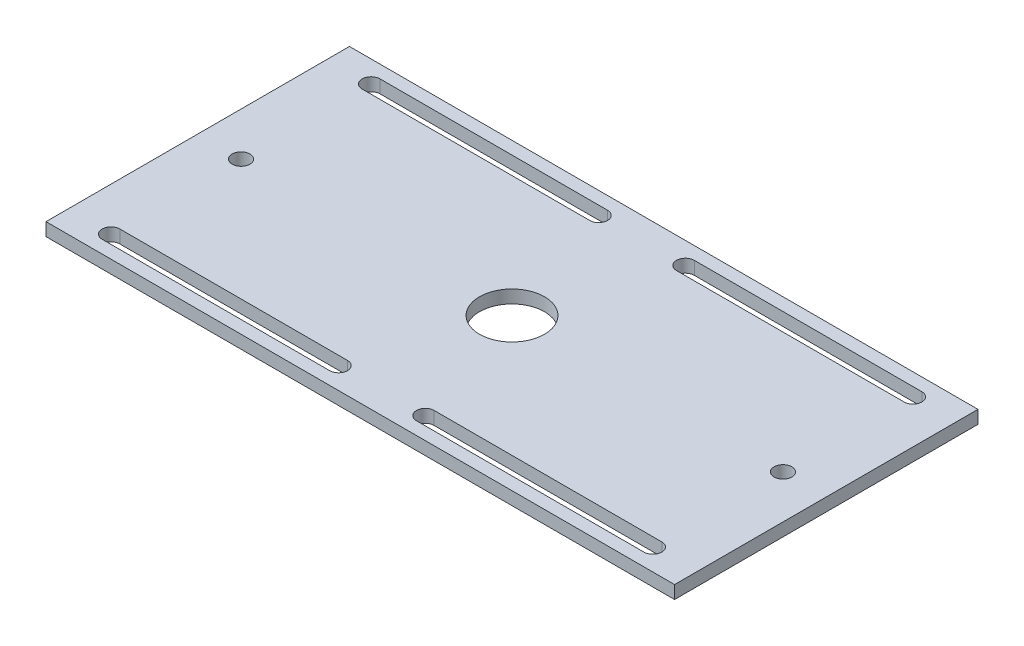
from build123d import *

# Parameters (mm, degrees)
SKETCH_1_W      = 290
SKETCH_1_H      = 140
SKETCH_1_R      = 4.1
SKETCH_1_R_2    = 15
EXTRUDE_1_DEPTH = 6


with BuildPart() as part:
    # Эскиз1 → Бобышка-Вытянуть1 (new body)
    with BuildSketch(Plane(origin=(0, 0, 0), x_dir=(1, 0, 0), z_dir=(0, 1, 0))):
        Rectangle(SKETCH_1_W, SKETCH_1_H)
        with Locations((-125, 0)):
            Circle(SKETCH_1_R, mode=Mode.SUBTRACT)
        with Locations((125, 0)):
            Circle(SKETCH_1_R, mode=Mode.SUBTRACT)
        Circle(SKETCH_1_R_2, mode=Mode.SUBTRACT)
        with BuildLine():
            Line((-125, 64.1), (-20, 64.1))
            ThreePointArc((-20, 64.1), (-15.9, 60), (-20, 55.9))
            Line((-20, 55.9), (-125, 55.9))
            ThreePointArc((-125, 55.9), (-129.1, 60), (-125, 64.1))
        make_face(mode=Mode.SUBTRACT)
        with BuildLine():
            Line((-125, -55.9), (-20, -55.9))
            ThreePointArc((-20, -55.9), (-15.9, -60), (-20, -64.1))
            Line((-20, -64.1), (-125, -64.1))
            ThreePointArc((-125, -64.1), (-129.1, -60), (-125, -55.9))
        make_face(mode=Mode.SUBTRACT)
        with BuildLine():
            Line((125, -64.1), (20, -64.1))
            ThreePointArc((20, -64.1), (15.9, -60), (20, -55.9))
            Line((20, -55.9), (125, -55.9))
            ThreePointArc((125, -55.9), (129.1, -60), (125, -64.1))
        make_face(mode=Mode.SUBTRACT)
        with BuildLine():
            Line((125, 55.9), (20, 55.9))
            ThreePointArc((20, 55.9), (15.9, 60), (20, 64.1))
            Line((20, 64.1), (125, 64.1))
            ThreePointArc((125, 64.1), (129.1, 60), (125, 55.9))
        make_face(mode=Mode.SUBTRACT)
    extrude(amount=EXTRUDE_1_DEPTH)


solid = part.part
